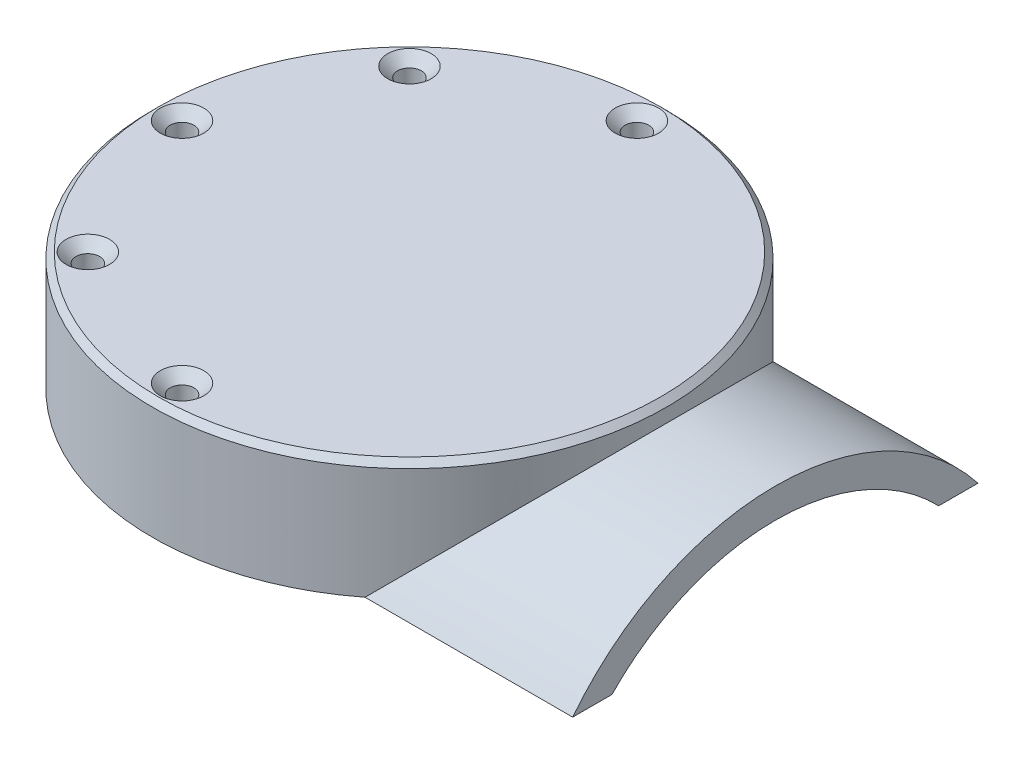
from build123d import *

# Parameters (mm, degrees)
SKETCH_1_W                  = 26
SKETCH_1_H                  = 28
SKETCH_2_W                  = 37
SKETCH_2_H                  = 26
CHAMFER_1_SIZE              = 0.6
SKETCH_4_W                  = 21
SKETCH_4_H                  = 26
SKETCH_5_W                  = 37
SKETCH_5_H                  = 23
CUT_EXTRUDE_1_DEPTH         = 16
CUT_EXTRUDE_1_DEPTH_BACK    = 54.188344657
HOLE_WIZARD_M21_D           = 2.4
HOLE_WIZARD_M21_CSINK_D     = 4.4
HOLE_WIZARD_M21_CSINK_ANGLE = 90
PATTERN_CIRCULAR_1_COUNT    = 3
PATTERN_CIRCULAR_1_ANGLE    = 90
F_1_THE_OTHER_WAY_COUNT     = 3
F_1_THE_OTHER_WAY_ANGLE     = 90


with BuildPart() as part:
    # Эскиз1 → Повернуть1 (revolve)
    with BuildSketch(Plane.XY):
        with Locations((-13, 14)):
            Rectangle(SKETCH_1_W, SKETCH_1_H)
    revolve(axis=Axis((0, 0, 0), (0, 1, 0)))

    # Эскиз2 → Повернуть2 (revolve)
    with BuildSketch(Plane.XY):
        with Locations((18.5, 13)):
            Rectangle(SKETCH_2_W, SKETCH_2_H)
    revolve(axis=Axis((0, 0, 0), (1, 0, 0)))

    # Фаска1
    chamfer_1_edges = [part.edges().sort_by_distance(p)[0] for p in [
        (26, 28, 0),
    ]]
    chamfer(chamfer_1_edges, length=CHAMFER_1_SIZE)

    # Эскиз4 → Вырез-Повернуть1 (revolve, cut)
    with BuildSketch(Plane.XY):
        with Locations((-10.5, 13)):
            Rectangle(SKETCH_4_W, SKETCH_4_H)
    revolve(axis=Axis((0, 0, 0), (0, 1, 0)), mode=Mode.SUBTRACT)

    # Эскиз5 → Вырез-Повернуть2 (revolve, cut)
    with BuildSketch(Plane.XY):
        with Locations((18.5, 11.5)):
            Rectangle(SKETCH_5_W, SKETCH_5_H)
    revolve(axis=Axis((0, 0, 0), (1, 0, 0)), mode=Mode.SUBTRACT)

    # Эскиз6 → Вырез-Вытянуть1 (cut, two sides: drawn at the far end of the back side and taken through both)
    with BuildSketch(Plane(origin=(0, 0, 0), x_dir=(1, 0, 0), z_dir=(0, 1, 0)).offset(-CUT_EXTRUDE_1_DEPTH_BACK)):
        with BuildLine():
            Line((0, 26), (37, 26))
            Line((37, 26), (37, -26))
            Line((37, -26), (0, -26))
            ThreePointArc((0, -26), (-26, 0), (0, 26))
        make_face()
    extrude(amount=CUT_EXTRUDE_1_DEPTH + CUT_EXTRUDE_1_DEPTH_BACK, mode=Mode.SUBTRACT)

    # Зенковка для винта с потайной головкой M21 (through all)
    with Locations(Plane(origin=(0, 28, 0), x_dir=(1, 0, 0), z_dir=(0, 1, 0))):
        with Locations((-23, 0)):
            hole_wizard_m21 = CounterSinkHole(HOLE_WIZARD_M21_D / 2, HOLE_WIZARD_M21_CSINK_D / 2, counter_sink_angle=HOLE_WIZARD_M21_CSINK_ANGLE)

    # Круговой массив1: Зенковка для винта с потайной головкой M21 ×3 about axis
    pattern_circular_1_axis = Axis((0, 28, 0), (0, 1, 0))
    for i in range(1, PATTERN_CIRCULAR_1_COUNT):
        add(hole_wizard_m21.rotate(pattern_circular_1_axis, i * PATTERN_CIRCULAR_1_ANGLE / (PATTERN_CIRCULAR_1_COUNT - 1)), mode=Mode.SUBTRACT)

    # 1 the other way: Зенковка для винта с потайной головкой M21 ×3 about axis
    f_1_the_other_way_axis = Axis((0, 28, 0), (0, -1, 0))
    for i in range(1, F_1_THE_OTHER_WAY_COUNT):
        add(hole_wizard_m21.rotate(f_1_the_other_way_axis, i * F_1_THE_OTHER_WAY_ANGLE / (F_1_THE_OTHER_WAY_COUNT - 1)), mode=Mode.SUBTRACT)


solid = part.part
